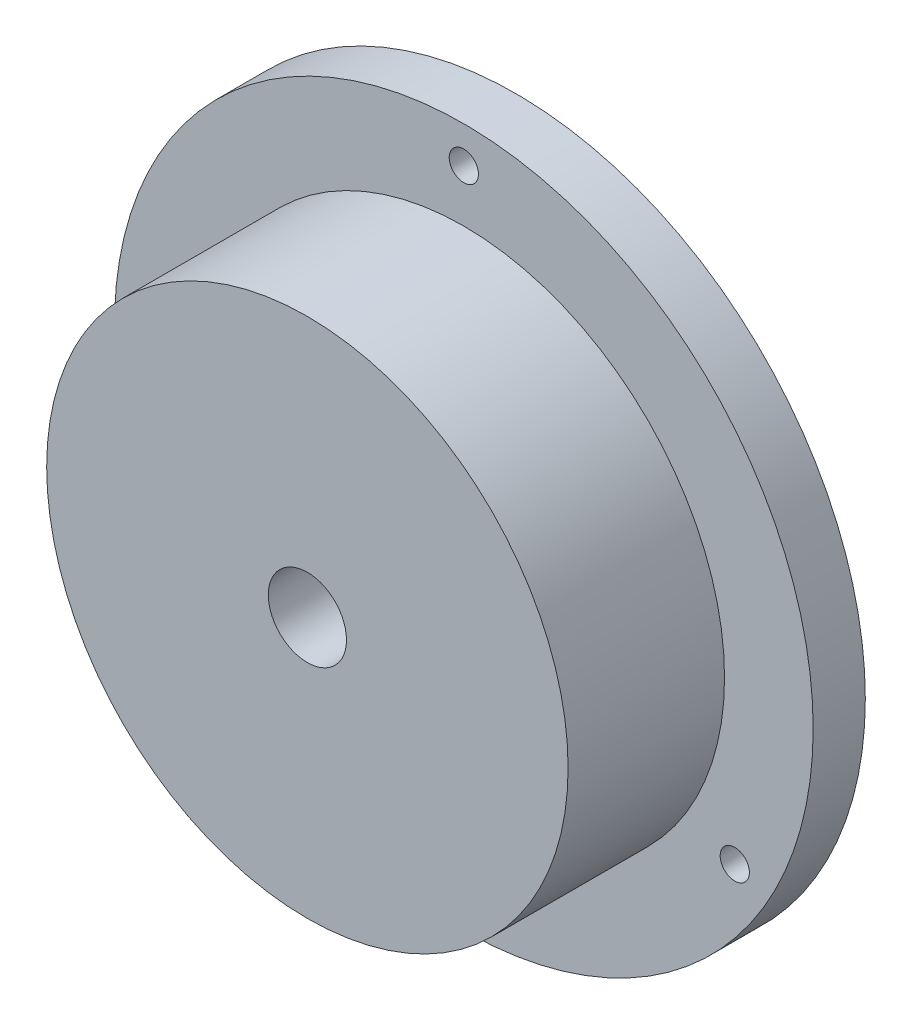
from build123d import *

# Parameters (mm, degrees)
SKETCH1_R                      = 21.2725
BOSS_EXTRUDE1_DEPTH            = 3.175
SKETCH2_R                      = 15.875
BOSS_EXTRUDE2_DEPTH            = 9.525
F_3_16_0_1875_DIAMETER_HOLE1_D = 4.7625
F_2_56_TAPPED_HOLE3_D          = 1.778
CIRPATTERN1_COUNT              = 3
F_8_32_TAPPED_HOLE1_D          = 3.4544
F_8_32_TAPPED_HOLE1_DEPTH      = 21.2715
F_8_32_TAPPED_HOLE1_TIP        = 1.037806461


with BuildPart() as part:
    # Sketch1 → Boss-Extrude1 (new body)
    with BuildSketch(Plane.XY):
        Circle(SKETCH1_R)
    extrude(amount=BOSS_EXTRUDE1_DEPTH)

    # Sketch2 → Boss-Extrude2 (add)
    with BuildSketch(Plane.XY.offset(3.175)):
        Circle(SKETCH2_R)
    extrude(amount=BOSS_EXTRUDE2_DEPTH)

    # 3/16 (0.1875) Diameter Hole1 (through all)
    with Locations(Plane.XY.offset(12.7)):
        with Locations((0, 0)):
            Hole(F_3_16_0_1875_DIAMETER_HOLE1_D / 2)

    # #2-56 Tapped Hole3 (through all)
    with Locations(Plane.XY.offset(3.175)):
        with Locations((0, 19.05)):
            f_2_56_tapped_hole3 = Hole(F_2_56_TAPPED_HOLE3_D / 2)

    # CirPattern1: #2-56 Tapped Hole3 ×3 about axis
    cirpattern1_axis = Axis((0, 0, 3.175), (0, 0, 1))
    for i in range(1, CIRPATTERN1_COUNT):
        add(f_2_56_tapped_hole3.rotate(cirpattern1_axis, i * 360 / CIRPATTERN1_COUNT), mode=Mode.SUBTRACT)

    # #8-32 Tapped Hole1
    with Locations(Plane.XZ.offset(21.2725)):
        with Locations((0, 7.9248)):
            Hole(F_8_32_TAPPED_HOLE1_D / 2, depth=F_8_32_TAPPED_HOLE1_DEPTH)
            with Locations((0, 0, -(F_8_32_TAPPED_HOLE1_DEPTH + F_8_32_TAPPED_HOLE1_TIP / 2))):  # 118° drill point
                Cone(0, F_8_32_TAPPED_HOLE1_D / 2, F_8_32_TAPPED_HOLE1_TIP, mode=Mode.SUBTRACT)


solid = part.part
